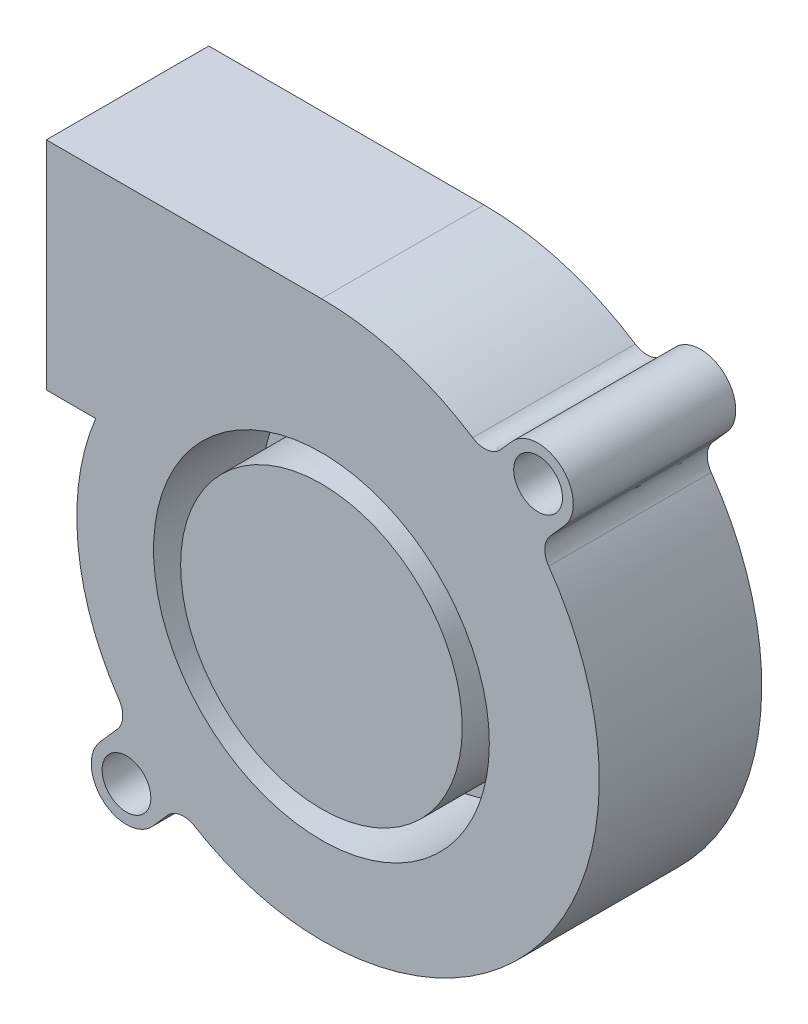
from build123d import *

# Parameters (mm, degrees)
SKETCH_1_R          = 2.25
SKETCH_1_R_2        = 13
EXTRUDE_1_DEPTH     = 15
EXTRUDE_START       = -15
SKETCH_2_R          = 13
EXTRUDE_2_DEPTH     = 15
SKETCH_3_R          = 15.5
SKETCH_3_R_2        = 13
CUT_EXTRUDE_1_DEPTH = 10
FILLET_2_R          = 2
SHELL_1_T           = -2


with BuildPart() as part:
    # 草图1 → 凸台-拉伸1 (new body)
    with BuildSketch(Plane.XY):
        with BuildLine():
            Line((-20.509328188, 29.527748201), (-45.909328188, 29.527748201))
            Line((-45.909328188, 29.527748201), (-45.909328188, 9.527748201))
            Line((-45.909328188, 9.527748201), (-41.345035516, 9.527748201))
            ThreePointArc((-41.345035516, 9.527748201), (-42.891279982, -2.208471939), (-38.288719604, -13.114716624))
            Line((-38.288719604, -13.114716624), (-40.944647776, -16.120109029))
            ThreePointArc((-40.944647776, -16.120109029), (-40.661470992, -20.707571357), (-36.07400866, -20.424394637))
            Line((-36.07400866, -20.424394637), (-33.582654856, -17.603814511))
            ThreePointArc((-33.582654856, -17.603814511), (-27.370227174, -20.704922292), (-20.509328188, -21.772251799))
            ThreePointArc((-20.509328188, -21.772251799), (2.605029944, -7.24200666), (-0.468314839, 19.886504679))
            Line((-0.468314839, 19.886504679), (2.117446855, 22.813968467))
            ThreePointArc((2.117446855, 22.813968467), (1.525885658, 27.261599934), (-2.944647715, 26.87989104))
            Line((-2.944647715, 26.87989104), (-5.1306618, 24.406243523))
            ThreePointArc((-5.1306618, 24.406243523), (-12.404804913, 28.213713407), (-20.509328188, 29.527748201))
        make_face()
        with Locations((-38.509328188, -18.272251799)):
            Circle(SKETCH_1_R, mode=Mode.SUBTRACT)
        with Locations((-0.509328188, 24.727748201)):
            Circle(SKETCH_1_R, mode=Mode.SUBTRACT)
        with Locations((-20.509328188, 1.727748201)):
            Circle(SKETCH_1_R_2, mode=Mode.SUBTRACT)
    extrude(amount=EXTRUDE_1_DEPTH)

    # 草图2 → 凸台-拉伸2 (add)
    with BuildSketch(Plane.XY.offset(15).offset(EXTRUDE_START)):
        with Locations((-20.509328188, 1.727748201)):
            Circle(SKETCH_2_R)
    extrude(amount=EXTRUDE_2_DEPTH)

    # 草图3 → 切除-拉伸1 (cut)
    with BuildSketch(Plane.XY.offset(15)):
        with Locations((-20.509328188, 1.727748201)):
            Circle(SKETCH_3_R)
        with Locations((-20.509328188, 1.727748201)):
            Circle(SKETCH_3_R_2, mode=Mode.SUBTRACT)
    extrude(amount=-CUT_EXTRUDE_1_DEPTH, mode=Mode.SUBTRACT)

    # 变化圆角2
    fillet_2_edges = [part.edges().sort_by_distance(p)[0] for p in [
        (-5.1306618, 24.406243523, 7.5),
        (-0.468314839, 19.886504679, 7.5),
        (-38.288719604, -13.114716624, 7.5),
        (-33.582654856, -17.603814511, 7.5),
    ]]
    fillet(fillet_2_edges, radius=FILLET_2_R)

    # 抽壳1
    shell_1_openings = [part.faces().sort_by_distance(p)[0] for p in [
        (-45.909328188, 19.527748201, 7.5),
    ]]
    offset(amount=SHELL_1_T, openings=shell_1_openings, kind=Kind.INTERSECTION)


solid = part.part
